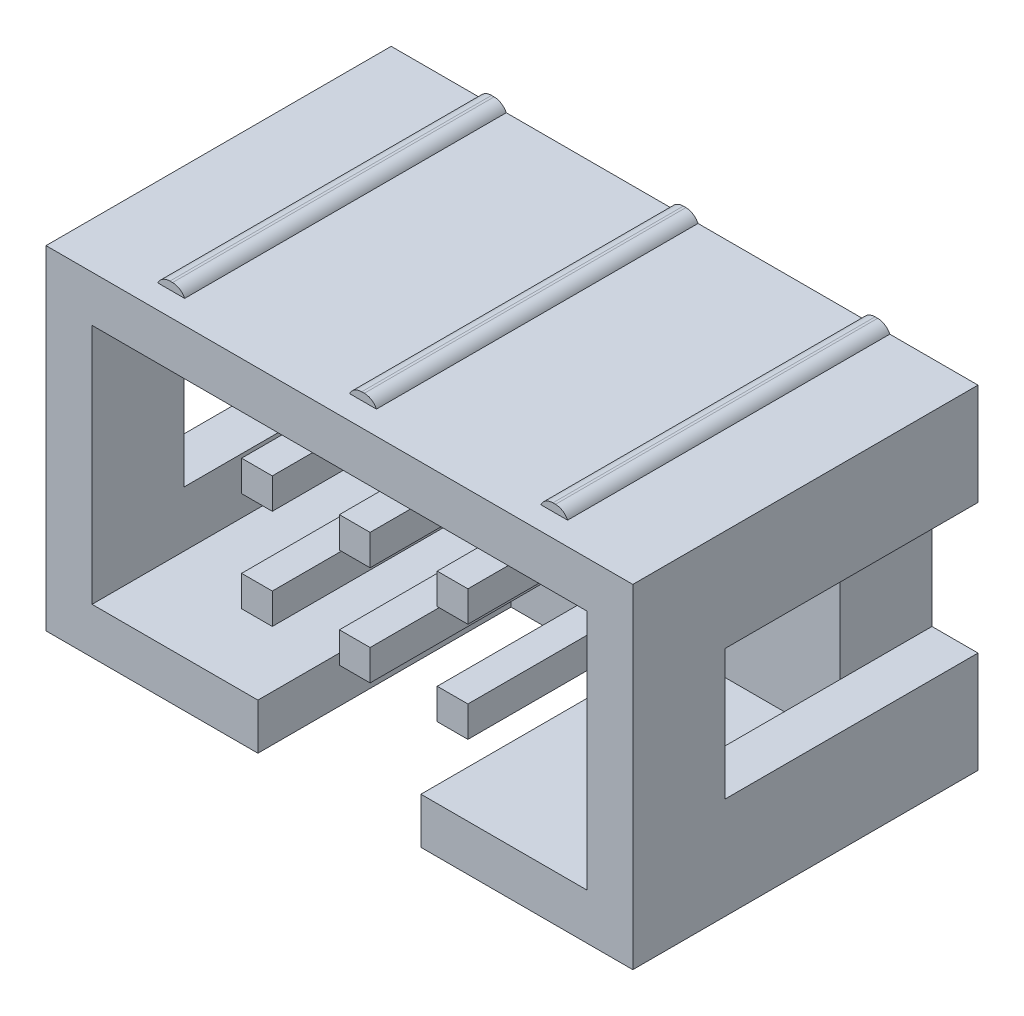
from build123d import *

# Parameters (mm, degrees)
SKICA1_W                 = 15.3
SKICA1_H                 = 8.7
P_IDAT_VYSUNUT_M1_DEPTH  = 9
SKICA2_W                 = 12.9
SKICA2_H                 = 6.3
ODEBRAT_VYSUNUT_M1_DEPTH = 6.6
SKICA3_W                 = 4.25
SKICA3_H                 = 6.6
ODEBRAT_VYSUNUT_M2_DEPTH = 6.6
SKICA4_W                 = 6.6
SKICA4_H                 = 3.4
ODEBRAT_VYSUNUT_M3_DEPTH = 1.2
SKICA5_W                 = 6.6
SKICA5_H                 = 3.4
ODEBRAT_VYSUNUT_M4_DEPTH = 1.2
SKICA6_W                 = 0.7
SKICA6_H                 = 8.4
SKICA6_H_2               = 8.384805524
P_IDAT_VYSUNUT_M2_DEPTH  = 0.2
ZAOBLIT2_R               = 0.35
ZAOBLIT3_R               = 0.35
SKICA7_W                 = 0.8
SKICA7_H                 = 0.8
P_IDAT_VYSUNUT_M3_DEPTH  = 6.2


with BuildPart() as part:
    # Skica1 → Přidat vysunutím1 (new body)
    with BuildSketch(Plane.XY):
        Rectangle(SKICA1_W, SKICA1_H)
    extrude(amount=P_IDAT_VYSUNUT_M1_DEPTH)

    # Skica2 → Odebrat vysunutím1 (cut)
    with BuildSketch(Plane.XY.offset(9)):
        Rectangle(SKICA2_W, SKICA2_H)
    extrude(amount=-ODEBRAT_VYSUNUT_M1_DEPTH, mode=Mode.SUBTRACT)

    # Skica3 → Odebrat vysunutím2 (cut)
    with BuildSketch(Plane(origin=(0, -4.35, 0), x_dir=(-1, 0, 0), z_dir=(0, -1, 0))):
        with Locations((0, -5.7)):
            Rectangle(SKICA3_W, SKICA3_H)
    extrude(amount=-ODEBRAT_VYSUNUT_M2_DEPTH, mode=Mode.SUBTRACT)

    # Skica4 → Odebrat vysunutím3 (cut)
    with BuildSketch(Plane.ZY.offset(7.65)):
        with Locations((3.3, 0)):
            Rectangle(SKICA4_W, SKICA4_H)
    extrude(amount=-ODEBRAT_VYSUNUT_M3_DEPTH, mode=Mode.SUBTRACT)

    # Skica5 → Odebrat vysunutím4 (cut)
    with BuildSketch(Plane(origin=(7.65, 0, 0), x_dir=(0, 0, -1), z_dir=(1, 0, 0))):
        with Locations((-3.3, 0)):
            Rectangle(SKICA5_W, SKICA5_H)
    extrude(amount=-ODEBRAT_VYSUNUT_M4_DEPTH, mode=Mode.SUBTRACT)

    # Skica6 → Přidat vysunutím2 (add)
    with BuildSketch(Plane(origin=(0, 4.35, 0), x_dir=(1, 0, 0), z_dir=(0, 1, 0))):
        with Locations((5, -4.2)):
            Rectangle(SKICA6_W, SKICA6_H)
        with Locations((0, -4.192402762)):
            Rectangle(SKICA6_W, SKICA6_H_2)
        with Locations((-5, -4.192402762)):
            Rectangle(SKICA6_W, SKICA6_H_2)
    extrude(amount=P_IDAT_VYSUNUT_M2_DEPTH)

    # Zaoblit2
    # the kernel refuses this fillet: 0.35 mm, written as the material it takes off along each edge
    with BuildSketch(Plane(origin=(5.35, 4.55, 9.190569415), x_dir=(0, -1, 0), z_dir=(0, 0, -1))) as zaoblit2_piece_1:
        with BuildLine():
            CenterArc((0.35, 0.316227766), ZAOBLIT2_R, 180, 64.623066475)
            Line((0, 0.316227766), (-0.007, 0.316227766))
            Line((-0.007, 0.316227766), (-0.007, 0))
            Line((-0.007, 0), (0, -0.007))
            ThreePointArc((0, -0.007), (0.1, -0.007), (0.197, -0.006324555))
            Line((0.197, -0.006324555), (0.2, 0))
        make_face()
    extrude(amount=9.98113883, mode=Mode.SUBTRACT)

    # Zaoblit3
    # the kernel refuses this fillet: 0.35 mm, written as the material it takes off along each edge
    with BuildSketch(Plane(origin=(-5.35, 4.55, 9.175374939), x_dir=(1, 0, 0), z_dir=(0, 0, -1))) as zaoblit3_piece_1:
        with BuildLine():
            CenterArc((0.316227766, 0.35), ZAOBLIT3_R, 205.376933525, 64.623066475)
            Line((0, 0.2), (-0.006324555, 0.197))
            ThreePointArc((-0.006324555, 0.197), (-0.007, 0.1), (-0.007, 0))
            Line((-0.007, 0), (0, -0.007))
            Line((0, -0.007), (0.316227766, -0.007))
            Line((0.316227766, -0.007), (0.316227766, 0))
        make_face()
    extrude(amount=9.965944354, mode=Mode.SUBTRACT)
    with BuildSketch(Plane(origin=(-4.65, 4.55, -0.790569415), x_dir=(0, -1, 0), z_dir=(0, 0, 1))) as zaoblit3_piece_2:
        with BuildLine():
            CenterArc((0.35, -0.316227766), ZAOBLIT3_R, 115.376933525, 64.623066475)
            Line((0, -0.316227766), (-0.007, -0.316227766))
            Line((-0.007, -0.316227766), (-0.007, 0))
            Line((-0.007, 0), (0, 0.007))
            ThreePointArc((0, 0.007), (0.1, 0.007), (0.197, 0.006324555))
            Line((0.197, 0.006324555), (0.2, 0))
        make_face()
    extrude(amount=9.965944354, mode=Mode.SUBTRACT)
    with BuildSketch(Plane(origin=(-0.35, 4.55, -0.790569415), x_dir=(1, 0, 0), z_dir=(0, 0, 1))) as zaoblit3_piece_3:
        with BuildLine():
            CenterArc((0.316227766, -0.35), ZAOBLIT3_R, 90, 64.623066475)
            Line((0, -0.2), (-0.006324555, -0.197))
            ThreePointArc((-0.006324555, -0.197), (-0.007, -0.1), (-0.007, 0))
            Line((-0.007, 0), (0, 0.007))
            Line((0, 0.007), (0.316227766, 0.007))
            Line((0.316227766, 0.007), (0.316227766, 0))
        make_face()
    extrude(amount=9.965944354, mode=Mode.SUBTRACT)
    with BuildSketch(Plane(origin=(0.35, 4.55, 9.175374939), x_dir=(0, -1, 0), z_dir=(0, 0, -1))) as zaoblit3_piece_4:
        with BuildLine():
            CenterArc((0.35, 0.316227766), ZAOBLIT3_R, 180, 64.623066475)
            Line((0, 0.316227766), (-0.007, 0.316227766))
            Line((-0.007, 0.316227766), (-0.007, 0))
            Line((-0.007, 0), (0, -0.007))
            ThreePointArc((0, -0.007), (0.1, -0.007), (0.197, -0.006324555))
            Line((0.197, -0.006324555), (0.2, 0))
        make_face()
    extrude(amount=9.965944354, mode=Mode.SUBTRACT)
    with BuildSketch(Plane(origin=(4.65, 4.55, -0.790569415), x_dir=(0, -1, 0), z_dir=(0, 0, 1))) as zaoblit3_piece_5:
        with BuildLine():
            CenterArc((0.35, 0.316227766), ZAOBLIT3_R, 180, 64.623066475)
            Line((0, 0.316227766), (-0.007, 0.316227766))
            Line((-0.007, 0.316227766), (-0.007, 0))
            Line((-0.007, 0), (0, -0.007))
            ThreePointArc((0, -0.007), (0.1, -0.007), (0.197, -0.006324555))
            Line((0.197, -0.006324555), (0.2, 0))
        make_face()
    extrude(amount=9.98113883, mode=Mode.SUBTRACT)

    # Skica7 → Přidat vysunutím3 (add)
    with BuildSketch(Plane.XY.offset(2.4)):
        with Locations((-2.55, -1.3)):
            Rectangle(SKICA7_W, SKICA7_H)
        with Locations((-2.55, 1.3)):
            Rectangle(SKICA7_W, SKICA7_H)
        with Locations((0, -1.3)):
            Rectangle(SKICA7_W, SKICA7_H)
        with Locations((2.55, -1.3)):
            Rectangle(SKICA7_W, SKICA7_H)
        with Locations((2.55, 1.3)):
            Rectangle(SKICA7_W, SKICA7_H)
        with Locations((0, 1.3)):
            Rectangle(SKICA7_W, SKICA7_H)
    extrude(amount=P_IDAT_VYSUNUT_M3_DEPTH)


solid = part.part
